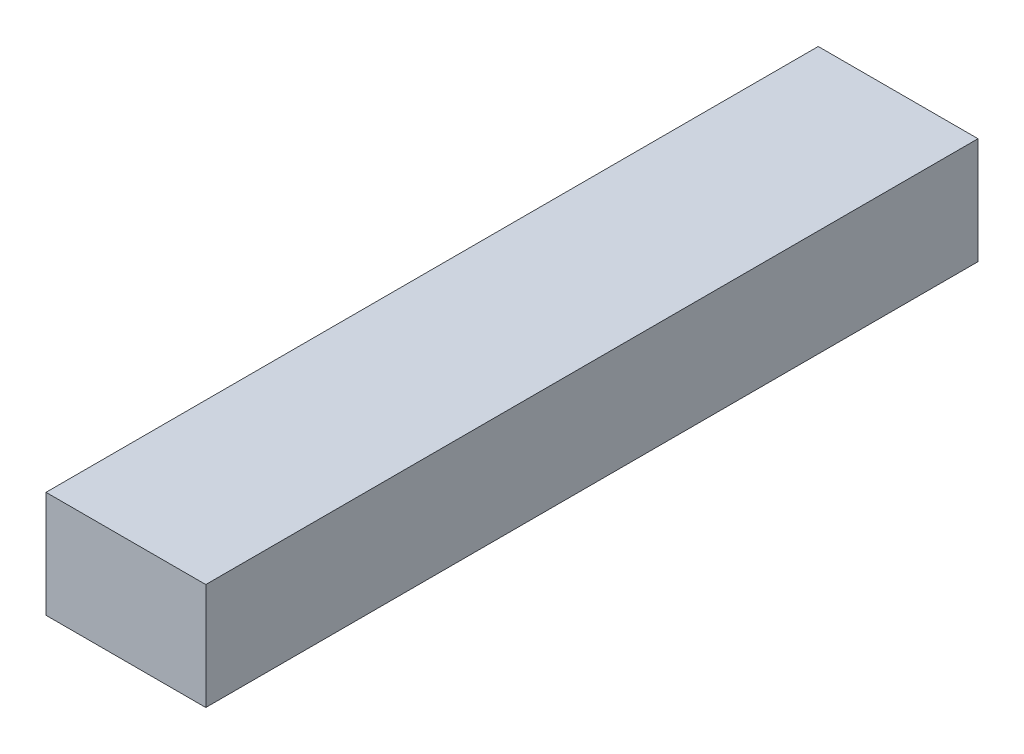
from build123d import *

# Parameters (mm, degrees)
SKETCH1_W           = 30
SKETCH1_H           = 145
BOSS_EXTRUDE1_DEPTH = 20


with BuildPart() as part:
    # Sketch1 → Boss-Extrude1 (new body)
    with BuildSketch(Plane(origin=(0, 0, 0), x_dir=(1, 0, 0), z_dir=(0, 1, 0))):
        with Locations((21.686746988, -34.284638554)):
            Rectangle(SKETCH1_W, SKETCH1_H)
    extrude(amount=BOSS_EXTRUDE1_DEPTH)


solid = part.part
